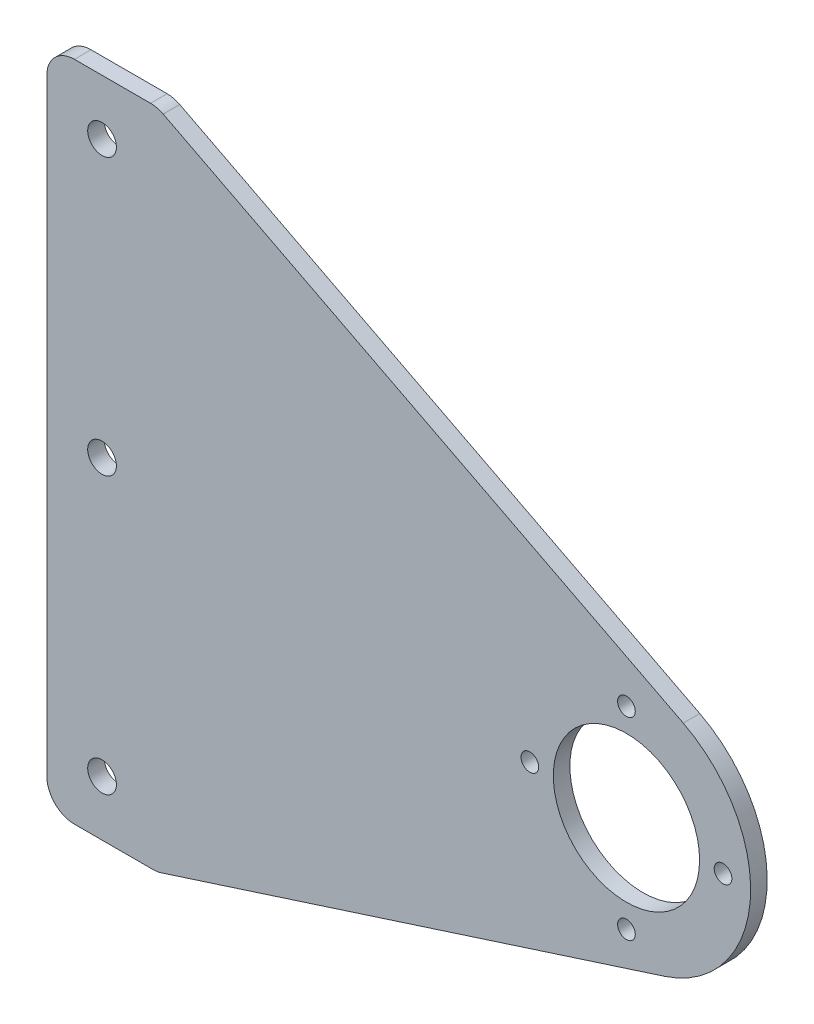
from build123d import *

# Parameters (mm, degrees)
SKETCH_2_R      = 13.25
SKETCH_2_R_2    = 1.6
SKETCH_2_R_3    = 2.6
EXTRUDE_1_DEPTH = 3
FILLET_3_R      = 5


with BuildPart() as part:
    # ｽｹｯﾁ2 → ﾎﾞｽ - 押し出し1 (new body)
    with BuildSketch(Plane.XY):
        with BuildLine():
            Line((-105, 69), (-105, -51))
            Line((-105, -51), (-85, -51))
            Line((-85, -51), (6.894675656, -21.417596681))
            ThreePointArc((6.894675656, -21.417596681), (22.424910395, -1.836680101), (10.287767529, 20.010293333))
            Line((10.287767529, 20.010293333), (-85, 69))
            Line((-85, 69), (-105, 69))
        make_face()
        Circle(SKETCH_2_R, mode=Mode.SUBTRACT)
        with Locations((0, 17.5)):
            Circle(SKETCH_2_R_2, mode=Mode.SUBTRACT)
        with Locations((17.5, 0)):
            Circle(SKETCH_2_R_2, mode=Mode.SUBTRACT)
        with Locations((0, -17.5)):
            Circle(SKETCH_2_R_2, mode=Mode.SUBTRACT)
        with Locations((-17.5, 0)):
            Circle(SKETCH_2_R_2, mode=Mode.SUBTRACT)
        with Locations((-95, 9)):
            Circle(SKETCH_2_R_3, mode=Mode.SUBTRACT)
        with Locations((-95, 59)):
            Circle(SKETCH_2_R_3, mode=Mode.SUBTRACT)
        with Locations((-95, -41)):
            Circle(SKETCH_2_R_3, mode=Mode.SUBTRACT)
    extrude(amount=EXTRUDE_1_DEPTH)

    # ﾌｨﾚｯﾄ3
    fillet_3_edges = [part.edges().sort_by_distance(p)[0] for p in [
        (-85, 69, 1.5),
        (-85, -51, 1.5),
        (-105, -51, 1.5),
        (-105, 69, 1.5),
    ]]
    fillet(fillet_3_edges, radius=FILLET_3_R)


solid = part.part
